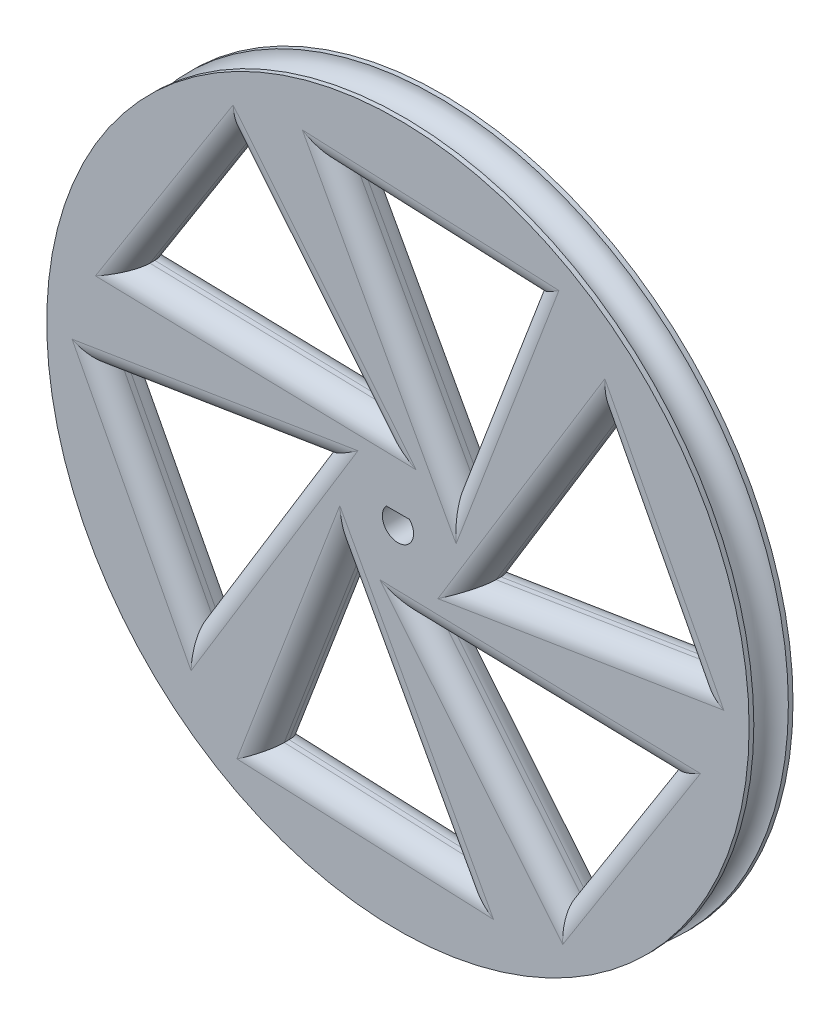
from build123d import *

# Parameters (mm, degrees)
CUT_EXTRUDE2_DEPTH = 5
CUT_EXTRUDE3_DEPTH = 5
CIRPATTERN2_COUNT  = 6
FILLET10_R         = 2
FILLET11_R         = 2
FILLET12_R         = 2
FILLET13_R         = 2
FILLET14_R         = 2
FILLET15_R         = 2
FILLET16_R         = 2
FILLET17_R         = 2
FILLET18_R         = 2
FILLET19_R         = 2
FILLET20_R         = 2
FILLET21_R         = 2
FILLET22_R         = 2
FILLET23_R         = 2
FILLET24_R         = 2


with BuildPart() as part:
    # Sketch4 → Revolve1 (revolve)
    with BuildSketch(Plane(origin=(0, 0, 0), x_dir=(0, 0, -1), z_dir=(1, 0, 0))):
        with BuildLine():
            Line((4.02, 36), (4.5, 36))
            Line((4.5, 36), (4.5, 0))
            Line((4.5, 0), (0, 0))
            Line((0, 0), (0, 36))
            Line((0, 36), (0.48, 36))
            ThreePointArc((0.48, 36), (2.25, 34.23), (4.02, 36))
        make_face()
    revolve(axis=Axis((0, 0, 0), (0, 0, -1)))

    # Sketch5 → Cut-Extrude2 (cut)
    with BuildSketch(Plane.XY):
        with BuildLine():
            Line((-1.192569588, 1.066666667), (1.192569588, 1.066666667))
            ThreePointArc((1.192569588, 1.066666667), (0, -1.6), (-1.192569588, 1.066666667))
        make_face()
    extrude(amount=-CUT_EXTRUDE2_DEPTH, mode=Mode.SUBTRACT)

    # Sketch6 → Cut-Extrude3 (cut)
    with BuildSketch(Plane.XY):
        Polygon((5.632988512, 6.058964241), (-6.34995561, 28), (13.65004439, 27.160501255), align=None)
    cut_extrude3 = extrude(amount=-CUT_EXTRUDE3_DEPTH, mode=Mode.SUBTRACT)

    # CirPattern2: Cut-Extrude3 ×6 about axis
    cirpattern2_axis = Axis((0, 0, 0), (0, 0, 1))
    for i in range(1, CIRPATTERN2_COUNT):
        add(cut_extrude3.rotate(cirpattern2_axis, i * 360 / CIRPATTERN2_COUNT), mode=Mode.SUBTRACT)

    # Fillet10
    fillet10_edges = [part.edges().sort_by_distance(p)[0] for p in [
        (-0.358483549, 17.029482121, 0),
    ]]
    fillet(fillet10_edges, radius=FILLET10_R)

    # Fillet11
    fillet11_edges = [part.edges().sort_by_distance(p)[0] for p in [
        (-9.563692284, 16.654664552, 0),
    ]]
    fillet(fillet11_edges, radius=FILLET11_R)

    # Fillet12
    fillet12_edges = [part.edges().sort_by_distance(p)[0] for p in [
        (-21.495424983, 17.840938138, 0),
    ]]
    fillet(fillet12_edges, radius=FILLET12_R)

    # Fillet13
    fillet13_edges = [part.edges().sort_by_distance(p)[0] for p in [
        (-14.778239433, 8.200750817, 0),
    ]]
    fillet(fillet13_edges, radius=FILLET13_R)

    # Fillet14
    fillet14_edges = [part.edges().sort_by_distance(p)[0] for p in [
        (9.174061682, 15.379354133, 0),
    ]]
    fillet(fillet14_edges, radius=FILLET14_R)

    # Fillet15
    fillet15_edges = [part.edges().sort_by_distance(p)[0] for p in [
        (14.568722355, 8.82519692, 0),
    ]]
    fillet(fillet15_edges, radius=FILLET15_R)

    # Fillet16
    fillet16_edges = [part.edges().sort_by_distance(p)[0] for p in [
        (17.905942214, -0.255293406, 0),
    ]]
    fillet(fillet16_edges, radius=FILLET16_R)

    # Fillet17
    fillet17_edges = [part.edges().sort_by_distance(p)[0] for p in [
        (3.536842456, 27.585002272, 0),
    ]]
    fillet(fillet17_edges, radius=FILLET17_R)

    # Fillet18
    fillet18_edges = [part.edges().sort_by_distance(p)[0] for p in [
        (25.657733959, 10.72950572, 0),
    ]]
    fillet(fillet18_edges, radius=FILLET18_R)

    # Fillet19
    fillet19_edges = [part.edges().sort_by_distance(p)[0] for p in [
        (14.927205904, -8.2042852, 0),
    ]]
    fillet(fillet19_edges, radius=FILLET19_R)

    # Fillet20
    fillet20_edges = [part.edges().sort_by_distance(p)[0] for p in [
        (8.731880532, -15.634647539, 0),
    ]]
    fillet(fillet20_edges, radius=FILLET20_R)

    # Fillet21
    fillet21_edges = [part.edges().sort_by_distance(p)[0] for p in [
        (-25.710219881, -10.629094147, -4.5),
        (-25.710219881, -10.629094147, 0),
        (-19.205208736, 0.044931804, 0),
        (-14.568722355, -8.82519692, -4.5),
        (-9.641516451, -16.609732748, 0),
        (-3.65004439, -27.580250628, 0),
        (0.358483549, -17.029482121, -4.5),
        (22.120891503, -16.855496552, 0),
    ]]
    fillet(fillet21_edges, radius=FILLET21_R)

    # Fillet22
    fillet22_edges = [part.edges().sort_by_distance(p)[0] for p in [
        (0.287061178, -16.898706181, 0),
    ]]
    fillet(fillet22_edges, radius=FILLET22_R)

    # Fillet23
    fillet23_edges = [part.edges().sort_by_distance(p)[0] for p in [
        (-14.491178254, -8.697955363, 0),
    ]]
    fillet(fillet23_edges, radius=FILLET23_R)

    # Fillet24
    fillet24_edges = [part.edges().sort_by_distance(p)[0] for p in [
        (-2.483893683, -27.62919973, -4.5),
        (-9.174061682, -15.379354133, -4.5),
        (-18.946270697, 0.086855935, -4.5),
        (-14.927205904, 8.2042852, -4.5),
        (-22.060175491, 16.951156481, -4.5),
        (-9.563692284, 16.654664552, -4.5),
        (-0.358483549, 17.029482121, -4.5),
        (3.65004439, 27.580250628, -4.5),
        (9.641516451, 16.609732748, -4.5),
        (14.568722355, 8.82519692, -4.5),
        (25.710219881, 10.629094147, -4.5),
        (19.205208736, -0.044931804, -4.5),
        (9.563692284, -16.654664552, -4.5),
        (14.927205904, -8.2042852, -4.5),
        (22.060175491, -16.951156481, -4.5),
    ]]
    fillet(fillet24_edges, radius=FILLET24_R)


solid = part.part
